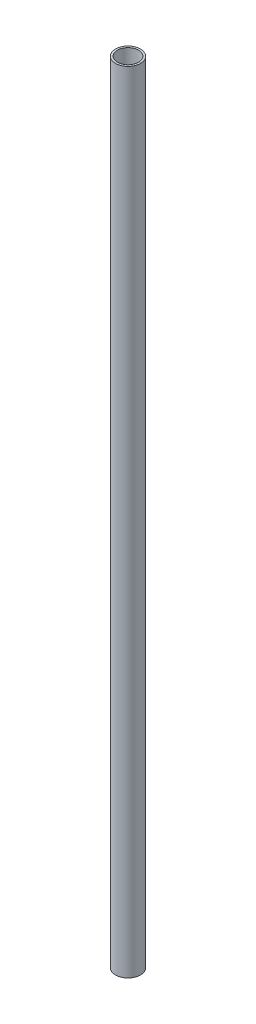
from build123d import *

# Parameters (mm, degrees)
SKETCH1_R           = 7.9375
SKETCH1_R_2         = 6.6929
BOSS_EXTRUDE1_DEPTH = 501.65


with BuildPart() as part:
    # Sketch1 → Boss-Extrude1 (new body)
    with BuildSketch(Plane(origin=(0, 0, 0), x_dir=(1, 0, 0), z_dir=(0, 1, 0))):
        Circle(SKETCH1_R)
        Circle(SKETCH1_R_2, mode=Mode.SUBTRACT)
    extrude(amount=BOSS_EXTRUDE1_DEPTH)


solid = part.part
